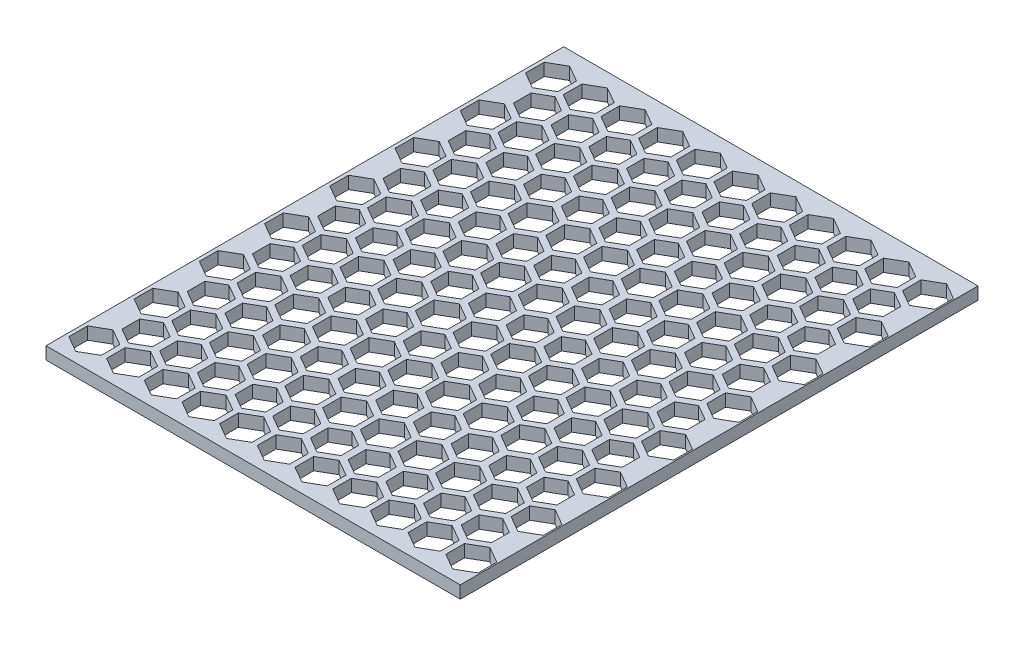
from build123d import *

# Parameters (mm, degrees)
SKETCH1_W            = 20
SKETCH1_H            = 25
BOSS_EXTRUDE1_DEPTH  = 0.6
CUT_EXTRUDE4_DEPTH   = 0.6
LPATTERN1_COUNT      = 11
LPATTERN1_PITCH      = 1.82
LPATTERN1_COUNT_DIR2 = 8
LPATTERN1_PITCH_DIR2 = 3.15
CUT_EXTRUDE5_DEPTH   = 0.6
LPATTERN2_COUNT      = 10
LPATTERN2_PITCH      = 1.82
LPATTERN2_COUNT_DIR2 = 7
LPATTERN2_PITCH_DIR2 = 3.15


with BuildPart() as part:
    # Sketch1 → Boss-Extrude1 (new body)
    with BuildSketch(Plane(origin=(0, 0, 0), x_dir=(1, 0, 0), z_dir=(0, 1, 0))):
        with Locations((10.376712329, 0.884703196)):
            Rectangle(SKETCH1_W, SKETCH1_H)
    extrude(amount=BOSS_EXTRUDE1_DEPTH)

    # Sketch3 → Cut-Extrude4 (cut)
    with BuildSketch(Plane(origin=(0, 0.6, 0), x_dir=(1, 0, 0), z_dir=(0, 1, 0))):
        Polygon((20.309957116, -9.784156286), (19.530246293, -9.333990033), (18.75053547, -9.784156286), (18.75053547, -10.684488793), (19.530246293, -11.134655047), (20.309957116, -10.684488793), align=None)
    cut_extrude4 = extrude(amount=-CUT_EXTRUDE4_DEPTH, mode=Mode.SUBTRACT)

    # LPattern1: Cut-Extrude4 11 × 8
    with Locations(*[(-i * LPATTERN1_PITCH, 0, -j * LPATTERN1_PITCH_DIR2) for i in range(LPATTERN1_COUNT) for j in range(LPATTERN1_COUNT_DIR2) if (i, j) != (0, 0)]):
        add(cut_extrude4, mode=Mode.SUBTRACT)

    # Sketch4 → Cut-Extrude5 (cut)
    with BuildSketch(Plane(origin=(0, 0.6, 0), x_dir=(1, 0, 0), z_dir=(0, 1, 0))):
        Polygon((18.634194996, -7.812521816), (17.898073403, -8.237521816), (17.898073403, -9.087521816), (18.634194996, -9.512521816), (19.370316589, -9.087521816), (19.370316589, -8.237521816), align=None)
    cut_extrude5 = extrude(amount=-CUT_EXTRUDE5_DEPTH, mode=Mode.SUBTRACT)

    # LPattern2: Cut-Extrude5 10 × 7
    with Locations(*[(-i * LPATTERN2_PITCH, 0, -j * LPATTERN2_PITCH_DIR2) for i in range(LPATTERN2_COUNT) for j in range(LPATTERN2_COUNT_DIR2) if (i, j) != (0, 0)]):
        add(cut_extrude5, mode=Mode.SUBTRACT)


solid = part.part
